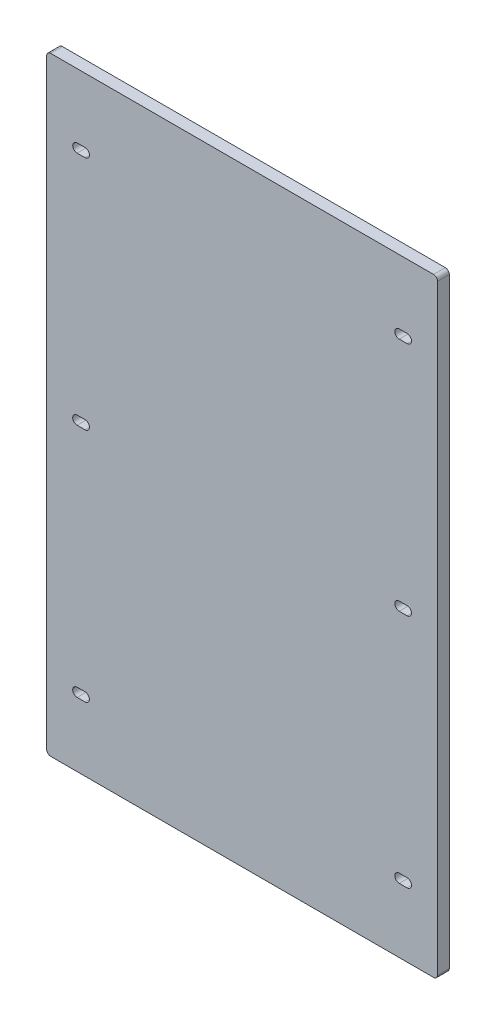
from build123d import *

# Parameters (mm, degrees)
CROQUIS1_W             = 199
CROQUIS1_H             = 310
BRIDA_BASE1_DEPTH      = 6
CORTAR_EXTRUIR1_DEPTH  = 10
MATRIZL1_COUNT         = 2
MATRIZL1_PITCH         = 120
MATRIZL1_COL_COUNT     = 2
MATRIZL1_COL_PITCH     = 120
SIMETR_A1_COPY_1_DEPTH = 10
SIMETR_A1_COPY_2_DEPTH = 10
REDONDEO1_R            = 2


# Sheet-metal steps are written as plain solids
with BuildPart() as part:
    # Croquis1 → Brida base1 (new body)
    with BuildSketch(Plane.XY):
        Rectangle(CROQUIS1_W, CROQUIS1_H)
    extrude(amount=-BRIDA_BASE1_DEPTH)

    # Croquis4 → Cortar-Extruir1 (cut)
    with BuildSketch(Plane.XY):
        with BuildLine():
            Line((-84, 2.25), (-80, 2.25))
            ThreePointArc((-80, 2.25), (-77.75, 0), (-80, -2.25))
            Line((-80, -2.25), (-84, -2.25))
            ThreePointArc((-84, -2.25), (-86.25, 0), (-84, 2.25))
        make_face()
    cortar_extruir1 = extrude(amount=-CORTAR_EXTRUIR1_DEPTH, mode=Mode.SUBTRACT)

    # MatrizL1: Cortar-Extruir1 ×2
    with Locations(*[(0, i * MATRIZL1_PITCH, 0) for i in range(1, MATRIZL1_COUNT)]):
        add(cortar_extruir1, mode=Mode.SUBTRACT)

    # MatrizL1 col: Cortar-Extruir1 ×2
    with Locations(*[(0, -i * MATRIZL1_COL_PITCH, 0) for i in range(1, MATRIZL1_COL_COUNT)]):
        add(cortar_extruir1, mode=Mode.SUBTRACT)

    # Simetría1: Cortar-Extruir1 across plane
    add(cortar_extruir1.mirror(Plane(origin=(0, 0, 0), x_dir=(0, 0, 1), z_dir=(1, 0, 0))), mode=Mode.SUBTRACT)

    # Simetría1 copy 1 sketch → Simetría1 copy 1 (cut)
    with BuildSketch(Plane(origin=(0, 120, 0), x_dir=(-1, 0, 0), z_dir=(0, 0, 1))):
        with BuildLine():
            Line((-84, -2.25), (-80, -2.25))
            ThreePointArc((-80, -2.25), (-77.75, 0), (-80, 2.25))
            Line((-80, 2.25), (-84, 2.25))
            ThreePointArc((-84, 2.25), (-86.25, 0), (-84, -2.25))
        make_face()
    extrude(amount=-SIMETR_A1_COPY_1_DEPTH, mode=Mode.SUBTRACT)

    # Simetría1 copy 2 sketch → Simetría1 copy 2 (cut)
    with BuildSketch(Plane(origin=(0, -120, 0), x_dir=(-1, 0, 0), z_dir=(0, 0, 1))):
        with BuildLine():
            Line((-84, -2.25), (-80, -2.25))
            ThreePointArc((-80, -2.25), (-77.75, 0), (-80, 2.25))
            Line((-80, 2.25), (-84, 2.25))
            ThreePointArc((-84, 2.25), (-86.25, 0), (-84, -2.25))
        make_face()
    extrude(amount=-SIMETR_A1_COPY_2_DEPTH, mode=Mode.SUBTRACT)

    # Redondeo1
    redondeo1_edges = [part.edges().sort_by_distance(p)[0] for p in [
        (-99.5, 155, -3),
        (99.5, 155, -3),
        (99.5, -155, -3),
        (-99.5, -155, -3),
    ]]
    fillet(redondeo1_edges, radius=REDONDEO1_R)


solid = part.part
